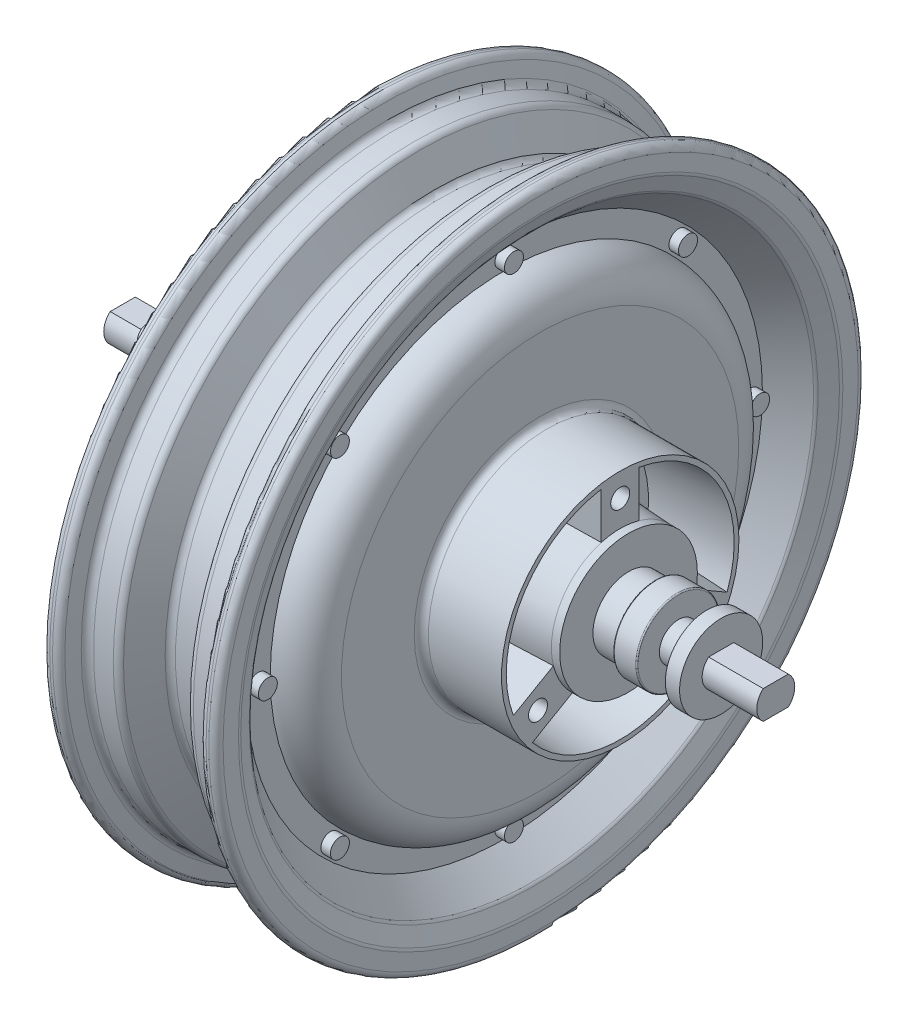
from build123d import *

# Parameters (mm, degrees)
BOSS_EXTRUDE1_DEPTH          = 4
BOSS_EXTRUDE1_DEPTH_BACK     = 77.25
SKETCH2_R                    = 4
CUT_EXTRUDE1_DEPTH           = 33.75
CUT_EXTRUDE1_DRAFT           = -4
CUT_EXTRUDE1_PROFILE_2_DEPTH = 33.75
CUT_EXTRUDE1_PROFILE_2_DRAFT = -4
CUT_EXTRUDE1_PROFILE_3_DEPTH = 33.75
CUT_EXTRUDE1_PROFILE_3_DRAFT = -4
SKETCH3_R                    = 4
CUT_EXTRUDE1_PROFILE_4_DEPTH = 33.75
CUT_EXTRUDE1_PROFILE_4_DRAFT = -4
CUT_EXTRUDE1_PROFILE_5_DEPTH = 33.75
CUT_EXTRUDE1_PROFILE_5_DRAFT = -4
CUT_EXTRUDE1_PROFILE_6_DEPTH = 33.75
CUT_EXTRUDE1_PROFILE_6_DRAFT = -4
FILLET1_R                    = 3
FILLET2_R                    = 6
FILLET3_R                    = 0.5
CUT_EXTRUDE2_DEPTH           = 23
CUT_EXTRUDE3_START           = -253
CUT_EXTRUDE3_DEPTH           = 22
SKETCH6_R                    = 12.5
CUT_EXTRUDE4_DEPTH           = 20
SKETCH7_R                    = 12
BOSS_EXTRUDE4_DEPTH          = 30
SKETCH8_R                    = 5
BOSS_EXTRUDE5_DEPTH          = 5
SKETCH9_R                    = 4
BOSS_EXTRUDE6_DEPTH          = 3


with BuildPart() as part:
    # Sketch1 → Revolve1 (revolve)
    with BuildSketch(Plane(origin=(0, 0, 0), x_dir=(1, 0, 0), z_dir=(0, 1, 0))):
        with BuildLine():
            Line((-7.5, 111.65), (7.5, 111.65))
            Line((7.5, 111.65), (15, 126.65))
            Line((15, 126.65), (27.5, 126.65))
            Line((27.5, 126.65), (30, 136.75))
            Line((30, 136.75), (36.5, 136.75))
            Line((36.5, 136.75), (36.5, 126.65))
            Line((36.5, 126.65), (33.25, 119.15))
            Line((33.25, 119.15), (21.25, 108.65))
            Line((21.25, 108.65), (21.25, 98.65))
            ThreePointArc((21.25, 98.65), (31.856601718, 94.256601718), (36.25, 83.65))
            Line((36.25, 83.65), (36.25, 50))
            Line((36.25, 50), (70, 50))
            Line((70, 50), (70, 29))
            Line((70, 29), (73.5, 29))
            Line((73.5, 29), (73.5, 15))
            Line((73.5, 15), (84.5, 15))
            Line((84.5, 15), (84.5, 17.5))
            Line((84.5, 17.5), (94.5, 17.5))
            Line((94.5, 17.5), (94.5, 8))
            Line((94.5, 8), (106.5, 8))
            Line((106.5, 8), (106.5, 17.5))
            Line((106.5, 17.5), (112.5, 17.5))
            Line((112.5, 17.5), (112.5, 8))
            Line((112.5, 8), (135.5, 8))
            Line((135.5, 8), (135.5, 0))
            Line((135.5, 0), (0, 0))
            Line((0, 0), (-139.5, 0))
            Line((-139.5, 0), (-139.5, 8))
            Line((-139.5, 8), (-117.5, 8))
            Line((-117.5, 8), (-117.5, 17.5))
            Line((-117.5, 17.5), (-111.5, 17.5))
            Line((-111.5, 17.5), (-111.5, 8))
            Line((-111.5, 8), (-99.5, 8))
            Line((-99.5, 8), (-99.5, 12.5))
            Line((-99.5, 12.5), (-79, 12.5))
            Line((-79, 12.5), (-79, 35))
            Line((-79, 35), (-67, 35))
            Line((-67, 35), (-67, 83.65))
            Line((-67, 83.65), (-52, 98.65))
            Line((-52, 98.65), (-52, 108.65))
            Line((-52, 108.65), (-21.25, 108.65))
            Line((-21.25, 108.65), (-33.25, 119.15))
            Line((-33.25, 119.15), (-36.5, 126.65))
            Line((-36.5, 126.65), (-36.5, 136.75))
            Line((-36.5, 136.75), (-30, 136.75))
            Line((-30, 136.75), (-27.5, 126.65))
            Line((-27.5, 126.65), (-15, 126.65))
            Line((-15, 126.65), (-7.5, 111.65))
        make_face()
    revolve(axis=Axis((0, 0, 0), (-1, 0, 0)))

    # Sketch2 → Boss-Extrude1 (add, two sides: drawn at the far end of the back side and taken through both)
    with BuildSketch(Plane.ZY.offset(52).offset(-BOSS_EXTRUDE1_DEPTH_BACK)):
        with Locations(Location((0, 103.65, 0), (0, 0, 180))):
            Circle(SKETCH2_R)
        with Locations(Location((73.29161787, 73.29161787, 0), (0, 0, 180))):
            Circle(SKETCH2_R)
        with Locations(Location((103.65, 0, 0), (0, 0, 180))):
            Circle(SKETCH2_R)
        with Locations(Location((73.29161787, -73.29161787, 0), (0, 0, 180))):
            Circle(SKETCH2_R)
        with Locations(Location((0, -103.65, 0), (0, 0, 180))):
            Circle(SKETCH2_R)
        with Locations(Location((-73.29161787, -73.29161787, 0), (0, 0, 180))):
            Circle(SKETCH2_R)
        with Locations(Location((-103.65, 0, 0), (0, 0, 180))):
            Circle(SKETCH2_R)
        with Locations(Location((-73.29161787, 73.29161787, 0), (0, 0, 180))):
            Circle(SKETCH2_R)
    extrude(amount=BOSS_EXTRUDE1_DEPTH + BOSS_EXTRUDE1_DEPTH_BACK)


with BuildPart() as cut_extrude1_tool:
    # Sketch3 → Cut-Extrude1 (with draft: the straight prism first)
    with BuildSketch(Plane(origin=(70, 0, 0), x_dir=(0, 0, -1), z_dir=(1, 0, 0))):
        with BuildLine():
            ThreePointArc((-28.140215409, -7.009156634), (-25.11473671, 14.5), (-8, 27.87471973))
            Line((-8, 27.87471973), (-8, 47.328638265))
            ThreePointArc((-8, 47.328638265), (-41.569219382, 24), (-44.987803064, -16.736115902))
            Line((-44.987803064, -16.736115902), (-28.140215409, -7.009156634))
        make_face()
    extrude(amount=-CUT_EXTRUDE1_DEPTH)
    # Cut-Extrude1: the draft: its side faces are tilted about the plane it starts from
    cut_extrude1_sides = [cut_extrude1_tool.faces().sort_by_distance(p)[0] for p in [
        (53.125, -11.872636268, 36.564009236),
        (53.125, 14.5, 25.11473671),
        (53.125, 37.601678997, 8),
        (53.125, 24, 41.569219382),
    ]]
    draft(cut_extrude1_sides, Plane(origin=(70, 0, 0), x_dir=(0, 0, -1), z_dir=(1, 0, 0)), CUT_EXTRUDE1_DRAFT)


with BuildPart() as part_1:
    add(part.part)

    # Cut-Extrude1: cut by cut_extrude1_tool
    add(cut_extrude1_tool.part, mode=Mode.SUBTRACT)


with BuildPart() as cut_extrude1_profile_2_tool:
    # Sketch3 → Cut-Extrude1 profile 2 (with draft: the straight prism first)
    with BuildSketch(Plane(origin=(70, 0, 0), x_dir=(0, 0, -1), z_dir=(1, 0, 0))):
        with BuildLine():
            Line((8, 47.328638265), (8, 27.87471973))
            ThreePointArc((8, 27.87471973), (23.162469644, 17.449928367), (29, 0))
            ThreePointArc((29, 0), (28.784251309, -3.530846438), (28.140215409, -7.009156634))
            Line((28.140215409, -7.009156634), (44.987803064, -16.736115902))
            ThreePointArc((44.987803064, -16.736115902), (47.240949118, -8.50251295), (48, 0))
            ThreePointArc((48, 0), (36.66060556, 30.98386677), (8, 47.328638265))
        make_face()
    extrude(amount=-CUT_EXTRUDE1_PROFILE_2_DEPTH)
    # Cut-Extrude1 profile 2: the draft: its side faces are tilted about the plane it starts from
    cut_extrude1_profile_2_sides = [cut_extrude1_profile_2_tool.faces().sort_by_distance(p)[0] for p in [
        (53.125, 24, -41.569219382),
        (53.125, 14.5, -25.11473671),
        (53.125, -11.872636268, -36.564009236),
        (53.125, 37.601678997, -8),
    ]]
    draft(cut_extrude1_profile_2_sides, Plane(origin=(70, 0, 0), x_dir=(0, 0, -1), z_dir=(1, 0, 0)), CUT_EXTRUDE1_PROFILE_2_DRAFT)


with BuildPart() as part_2:
    add(part_1.part)

    # Cut-Extrude1 profile 2: cut by cut_extrude1_profile_2_tool
    add(cut_extrude1_profile_2_tool.part, mode=Mode.SUBTRACT)


with BuildPart() as cut_extrude1_profile_3_tool:
    # Sketch3 → Cut-Extrude1 profile 3 (with draft: the straight prism first)
    with BuildSketch(Plane(origin=(70, 0, 0), x_dir=(0, 0, -1), z_dir=(1, 0, 0))):
        with BuildLine():
            Line((36.987803064, -30.592522363), (20.140215409, -20.865563095))
            ThreePointArc((20.140215409, -20.865563095), (0, -29), (-20.140215409, -20.865563095))
            Line((-20.140215409, -20.865563095), (-36.987803064, -30.592522363))
            ThreePointArc((-36.987803064, -30.592522363), (0, -48), (36.987803064, -30.592522363))
        make_face()
    extrude(amount=-CUT_EXTRUDE1_PROFILE_3_DEPTH)
    # Cut-Extrude1 profile 3: the draft: its side faces are tilted about the plane it starts from
    cut_extrude1_profile_3_sides = [cut_extrude1_profile_3_tool.faces().sort_by_distance(p)[0] for p in [
        (53.125, -48, 0),
        (53.125, -25.729042729, -28.564009236),
        (53.125, -29, 0),
        (53.125, -25.729042729, 28.564009236),
    ]]
    draft(cut_extrude1_profile_3_sides, Plane(origin=(70, 0, 0), x_dir=(0, 0, -1), z_dir=(1, 0, 0)), CUT_EXTRUDE1_PROFILE_3_DRAFT)


with BuildPart() as part_3:
    add(part_2.part)

    # Cut-Extrude1 profile 3: cut by cut_extrude1_profile_3_tool
    add(cut_extrude1_profile_3_tool.part, mode=Mode.SUBTRACT)


with BuildPart() as cut_extrude1_profile_4_tool:
    # Sketch3 → Cut-Extrude1 profile 4 (with draft: the straight prism first)
    with BuildSketch(Plane(origin=(70, 0, 0), x_dir=(0, 0, -1), z_dir=(1, 0, 0))):
        with Locations((34.641016151, -20)):
            Circle(SKETCH3_R)
    extrude(amount=-CUT_EXTRUDE1_PROFILE_4_DEPTH)
    # Cut-Extrude1 profile 4: the draft: its side faces are tilted about the plane it starts from
    cut_extrude1_profile_4_sides = [cut_extrude1_profile_4_tool.faces().sort_by_distance(p)[0] for p in [
        (53.125, -20, -30.641016151),
    ]]
    draft(cut_extrude1_profile_4_sides, Plane(origin=(70, 0, 0), x_dir=(0, 0, -1), z_dir=(1, 0, 0)), CUT_EXTRUDE1_PROFILE_4_DRAFT)


with BuildPart() as part_4:
    add(part_3.part)

    # Cut-Extrude1 profile 4: cut by cut_extrude1_profile_4_tool
    add(cut_extrude1_profile_4_tool.part, mode=Mode.SUBTRACT)


with BuildPart() as cut_extrude1_profile_5_tool:
    # Sketch3 → Cut-Extrude1 profile 5 (with draft: the straight prism first)
    with BuildSketch(Plane(origin=(70, 0, 0), x_dir=(0, 0, -1), z_dir=(1, 0, 0))):
        with Locations((-34.641016151, -20)):
            Circle(SKETCH3_R)
    extrude(amount=-CUT_EXTRUDE1_PROFILE_5_DEPTH)
    # Cut-Extrude1 profile 5: the draft: its side faces are tilted about the plane it starts from
    cut_extrude1_profile_5_sides = [cut_extrude1_profile_5_tool.faces().sort_by_distance(p)[0] for p in [
        (53.125, -20, 38.641016151),
    ]]
    draft(cut_extrude1_profile_5_sides, Plane(origin=(70, 0, 0), x_dir=(0, 0, -1), z_dir=(1, 0, 0)), CUT_EXTRUDE1_PROFILE_5_DRAFT)


with BuildPart() as part_5:
    add(part_4.part)

    # Cut-Extrude1 profile 5: cut by cut_extrude1_profile_5_tool
    add(cut_extrude1_profile_5_tool.part, mode=Mode.SUBTRACT)


with BuildPart() as cut_extrude1_profile_6_tool:
    # Sketch3 → Cut-Extrude1 profile 6 (with draft: the straight prism first)
    with BuildSketch(Plane(origin=(70, 0, 0), x_dir=(0, 0, -1), z_dir=(1, 0, 0))):
        with Locations((0, 40)):
            Circle(SKETCH3_R)
    extrude(amount=-CUT_EXTRUDE1_PROFILE_6_DEPTH)
    # Cut-Extrude1 profile 6: the draft: its side faces are tilted about the plane it starts from
    cut_extrude1_profile_6_sides = [cut_extrude1_profile_6_tool.faces().sort_by_distance(p)[0] for p in [
        (53.125, 40, 4),
    ]]
    draft(cut_extrude1_profile_6_sides, Plane(origin=(70, 0, 0), x_dir=(0, 0, -1), z_dir=(1, 0, 0)), CUT_EXTRUDE1_PROFILE_6_DRAFT)


with BuildPart() as part_6:
    add(part_5.part)

    # Cut-Extrude1 profile 6: cut by cut_extrude1_profile_6_tool
    add(cut_extrude1_profile_6_tool.part, mode=Mode.SUBTRACT)

    # Fillet1
    fillet1_edges = [part_6.edges().sort_by_distance(p)[0] for p in [
        (36.25, 0, 50),
        (33.25, 0, 119.15),
        (36.5, 0, 126.65),
        (36.5, 0, 136.75),
        (30, 0, 136.75),
        (27.5, 0, 126.65),
        (15, 0, 126.65),
        (7.5, 0, 111.65),
        (-7.5, 0, 111.65),
        (-15, 0, 126.65),
        (-27.5, 0, 126.65),
        (-30, 0, 136.75),
        (-36.5, 0, 136.75),
        (-36.5, 0, 126.65),
        (-33.25, 0, 119.15),
    ]]
    fillet(fillet1_edges, radius=FILLET1_R)

    # Fillet2
    fillet2_edges = [part_6.edges().sort_by_distance(p)[0] for p in [
        (-67, 0, 83.65),
        (-67, 0, 35),
    ]]
    fillet(fillet2_edges, radius=FILLET2_R)

    # Fillet3
    fillet3_edges = [part_6.edges().sort_by_distance(p)[0] for p in [
        (94.5, 0, 17.5),
        (84.5, 0, 17.5),
        (-52, 0, 108.65),
        (-52, 0, 98.65),
        (-79, 0, 35),
        (-99.5, 0, 12.5),
    ]]
    fillet(fillet3_edges, radius=FILLET3_R)

    # Sketch5 → Cut-Extrude2 (cut)
    with BuildSketch(Plane(origin=(135.5, 0, 0), x_dir=(0, 0, -1), z_dir=(1, 0, 0))):
        with BuildLine():
            Line((-5.291502622, 6), (5.291502622, 6))
            ThreePointArc((5.291502622, 6), (0, 8), (-5.291502622, 6))
        make_face()
        with BuildLine():
            Line((-5.291502622, -6), (5.291502622, -6))
            ThreePointArc((5.291502622, -6), (0, -8), (-5.291502622, -6))
        make_face()
    extrude(amount=-CUT_EXTRUDE2_DEPTH, mode=Mode.SUBTRACT)

    # Sketch5<2> → Cut-Extrude3 (cut)
    with BuildSketch(Plane(origin=(135.5, 0, 0), x_dir=(0, 0, -1), z_dir=(1, 0, 0)).offset(CUT_EXTRUDE3_START)):
        with BuildLine():
            Line((-5.291502622, 6), (5.291502622, 6))
            ThreePointArc((5.291502622, 6), (0, 8), (-5.291502622, 6))
        make_face()
        with BuildLine():
            Line((-5.291502622, -6), (5.291502622, -6))
            ThreePointArc((5.291502622, -6), (0, -8), (-5.291502622, -6))
        make_face()
    extrude(amount=-CUT_EXTRUDE3_DEPTH, mode=Mode.SUBTRACT)

    # Sketch6 → Cut-Extrude4 (cut)
    with BuildSketch(Plane.ZY.offset(79)):
        with Locations((24.395183951, -24.395183951)):
            Circle(SKETCH6_R)
    extrude(amount=-CUT_EXTRUDE4_DEPTH, mode=Mode.SUBTRACT)

    # Sketch7 → Boss-Extrude4 (add)
    with BuildSketch(Plane.ZY.offset(59)):
        with Locations((24.395183951, -24.395183951)):
            Circle(SKETCH7_R)
    extrude(amount=BOSS_EXTRUDE4_DEPTH)

    # Sketch8 → Boss-Extrude5 (add)
    with BuildSketch(Plane.ZY.offset(89)):
        with Locations((24.395183951, -18.395183951)):
            Circle(SKETCH8_R)
        with Locations((29.591336374, -27.395183951)):
            Circle(SKETCH8_R)
        with Locations((19.199031528, -27.395183951)):
            Circle(SKETCH8_R)
    extrude(amount=BOSS_EXTRUDE5_DEPTH)

    # Sketch9 → Boss-Extrude6 (add)
    with BuildSketch(Plane.ZY.offset(94)):
        with Locations((29.591336374, -27.395183951)):
            Circle(SKETCH9_R)
        with Locations((24.395183951, -18.395183951)):
            Circle(SKETCH9_R)
        with Locations((19.199031528, -27.395183951)):
            Circle(SKETCH9_R)
    extrude(amount=BOSS_EXTRUDE6_DEPTH)


solid = part_6.part
